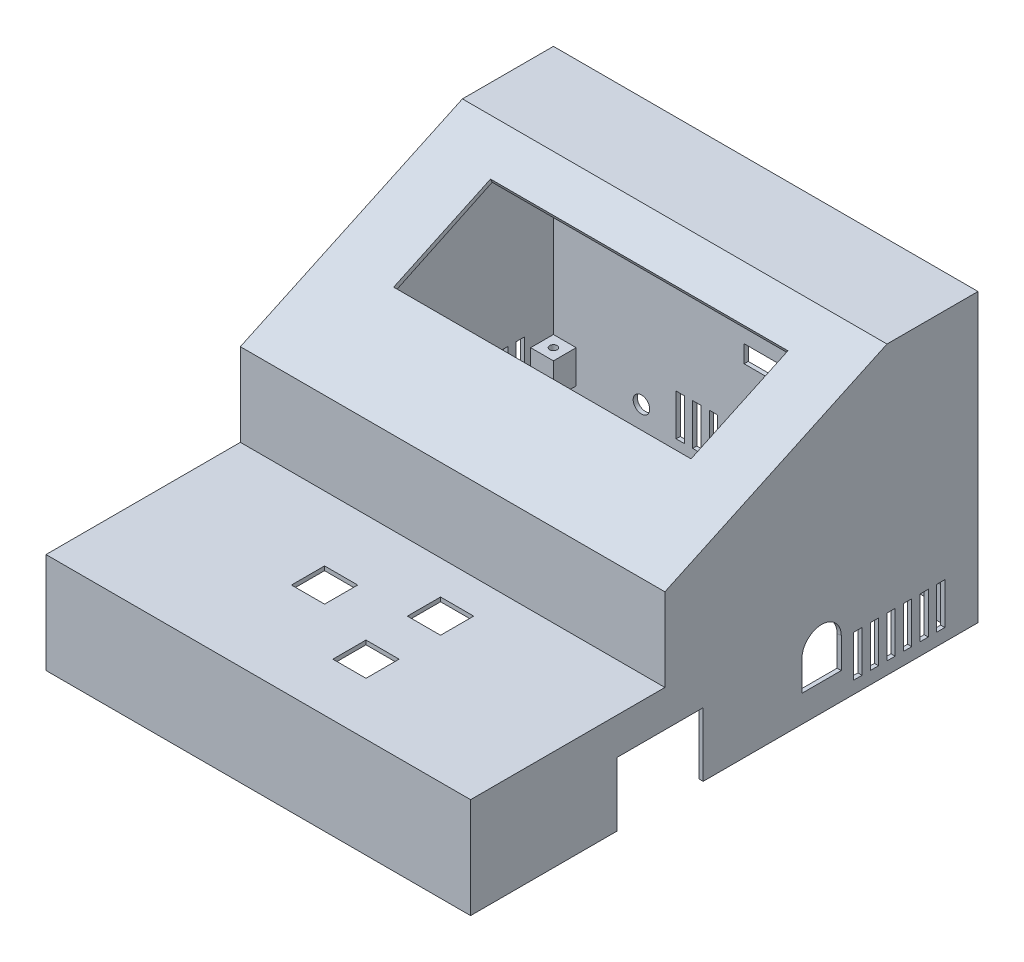
from build123d import *

# Parameters (mm, degrees)
SCHIZZO1_W                    = 104
SCHIZZO1_H                    = 124
SCHIZZO1_W_2                  = 100.5
SCHIZZO1_H_2                  = 120.5
ESTRUSIONE_ESTRUSIONE1_DEPTH  = 25.5
ESTRUSIONE_ESTRUSIONE2_START  = 5
SCHIZZO3_W                    = 5
SCHIZZO3_H                    = 5
ESTRUSIONE_ESTRUSIONE2_DEPTH  = 10
SCHIZZO4_W                    = 104
SCHIZZO4_H                    = 47.67
ESTRUSIONE_ESTRUSIONE3_DEPTH  = 1.75
SCHIZZO5_W                    = 8
SCHIZZO5_H                    = 8
TAGLIO_ESTRUSIONE1_DEPTH      = 12.75
SCHIZZO8_W                    = 8
SCHIZZO8_H                    = 8
TAGLIO_ESTRUSIONE2_DEPTH      = 12.75
ESTRUSIONE_ESTRUSIONE4_DEPTH  = 25
SCHIZZO11_W                   = 104
SCHIZZO11_H                   = 22.72
ESTRUSIONE_ESTRUSIONE5_DEPTH  = 1.75
SCHIZZO13_W                   = 1.75
SCHIZZO13_H                   = 53.61
ESTRUSIONE_ESTRUSIONE6_DEPTH  = 26.75
TAGLIO_ESTRUSIONE3_DEPTH      = 117
TAGLIO_ESTRUSIONE3_DEPTH_BACK = 41.75
LOFT4_START                   = 29.167010472
LOFT4_OUTLINE_W               = 104
LOFT4_OUTLINE_H               = 59.892229265
LOFT4_DEPTH                   = 1.586024503
SCHIZZO16_W                   = 71.8
SCHIZZO16_H                   = 25.8
TAGLIO_ESTRUSIONE4_DEPTH      = 10
SCHIZZO17_W                   = 104
SCHIZZO17_H                   = 124
SCHIZZO17_W_2                 = 100.5
SCHIZZO17_H_2                 = 120.5
ESTRUSIONE_ESTRUSIONE7_DEPTH  = 20
SCHIZZO19_W                   = 8
SCHIZZO19_H                   = 1.75
ESTRUSIONE_ESTRUSIONE8_DEPTH  = 0.25
SCHIZZO20_W                   = 7.75
SCHIZZO20_H                   = 1.75
ESTRUSIONE_ESTRUSIONE9_DEPTH  = 0.25
SCHIZZO21_W                   = 7.75
SCHIZZO21_H                   = 1.75
TAGLIO_ESTRUSIONE5_DEPTH      = 0.25
SCHIZZO22_W                   = 8
SCHIZZO22_H                   = 1.75
TAGLIO_ESTRUSIONE6_DEPTH      = 0.25
SCHIZZO23_W                   = 8
SCHIZZO23_H                   = 1.75
ESTRUSIONE_ESTRUSIONE10_DEPTH = 0.25
SCHIZZO37_W                   = 100.5
SCHIZZO37_H                   = 45.92
SCHIZZO37_W_2                 = 8
SCHIZZO37_H_2                 = 8
SCHIZZO37_W_3                 = 7.75
ESTRUSIONE_ESTRUSIONE17_DEPTH = 20
SCHIZZO38_W                   = 104
SCHIZZO38_H                   = 47.67
SCHIZZO38_W_2                 = 7.75
SCHIZZO38_H_2                 = 8
SCHIZZO38_W_3                 = 8
TAGLIO_ESTRUSIONE14_DEPTH     = 20
ESTRUSIONE_ESTRUSIONE18_REACH = 95.454
SCHIZZO39_W                   = 100.5
SCHIZZO39_H                   = 1.75
SCHIZZO31_W                   = 71.8
SCHIZZO31_H                   = 1.586024503
ESTRUSIONE_ESTRUSIONE14_DEPTH = 0.25
ESTRUSIONE_ESTRUSIONE15_DEPTH = 0.25
TAGLIO_ESTRUSIONE11_DEPTH     = 0.25
SCHIZZO34_W                   = 71.8
SCHIZZO34_H                   = 1.586024503
TAGLIO_ESTRUSIONE12_DEPTH     = 0.25
SCHIZZO35_W                   = 71.8
SCHIZZO35_H                   = 1.586024503
TAGLIO_ESTRUSIONE13_DEPTH     = 0.02
SCHIZZO36_W                   = 71.8
SCHIZZO36_H                   = 1.586024503
ESTRUSIONE_ESTRUSIONE16_DEPTH = 0.02
SCHIZZO40_W                   = 8
SCHIZZO40_H                   = 1.75
ESTRUSIONE_ESTRUSIONE19_DEPTH = 0.25
SCHIZZO41_W                   = 8
SCHIZZO41_H                   = 1.75
TAGLIO_ESTRUSIONE15_DEPTH     = 0.25
SCHIZZO42_W                   = 7.75
SCHIZZO42_H                   = 1.75
ESTRUSIONE_ESTRUSIONE20_DEPTH = 0.25
SCHIZZO43_W                   = 7.75
SCHIZZO43_H                   = 1.75
TAGLIO_ESTRUSIONE16_DEPTH     = 0.25
SCHIZZO44_W                   = 8
SCHIZZO44_H                   = 1.75
ESTRUSIONE_ESTRUSIONE21_DEPTH = 0.25
SCHIZZO45_W                   = 8
SCHIZZO45_H                   = 1.75
TAGLIO_ESTRUSIONE17_DEPTH     = 0.25
SCHIZZO46_W                   = 8
SCHIZZO46_H                   = 1.75
TAGLIO_ESTRUSIONE18_DEPTH     = 0.25
SCHIZZO48_W                   = 104
SCHIZZO48_H                   = 124
TAGLIO_ESTRUSIONE19_DEPTH     = 3
SCHIZZO49_W                   = 100.5
SCHIZZO49_H                   = 120.5
TAGLIO_ESTRUSIONE20_DEPTH     = 22.5
SCHIZZO50_W                   = 100.5
SCHIZZO50_H                   = 18.16459776
TAGLIO_ESTRUSIONE21_DEPTH     = 55.5
SCHIZZO51_W                   = 104
SCHIZZO51_H                   = 24.25
TAGLIO_ESTRUSIONE22_DEPTH     = 0.75
SCHIZZO52_W                   = 123.25
SCHIZZO52_H                   = 69.25
TAGLIO_ESTRUSIONE23_DEPTH     = 0.75
SCHIZZO53_W                   = 103.25
SCHIZZO53_H                   = 69.25
TAGLIO_ESTRUSIONE24_DEPTH     = 0.75
SCHIZZO54_W                   = 122.5
SCHIZZO54_H                   = 69.25
TAGLIO_ESTRUSIONE25_DEPTH     = 0.75
SCHIZZO55_W                   = 100.5
SCHIZZO55_H                   = 47.67
TAGLIO_ESTRUSIONE26_DEPTH     = 0.75
SCHIZZO56_W                   = 100.5
SCHIZZO56_H                   = 20.06607909
TAGLIO_ESTRUSIONE27_DEPTH     = 0.75
SCHIZZO57_W                   = 100.5
SCHIZZO57_H                   = 20.97
TAGLIO_ESTRUSIONE28_DEPTH     = 0.75
TAGLIO_ESTRUSIONE29_DEPTH     = 10
SCHIZZO59_W                   = 8.2
SCHIZZO59_H                   = 4.2
TAGLIO_ESTRUSIONE30_DEPTH     = 10
TAGLIO_ESTRUSIONE31_DEPTH     = 10
ESTRUSIONE_ESTRUSIONE22_START = -2
SCHIZZO61_W                   = 5.5
SCHIZZO61_H                   = 5.5
ESTRUSIONE_ESTRUSIONE22_DEPTH = 8
SCHIZZO62_R                   = 0.9
TAGLIO_ESTRUSIONE32_DEPTH     = 10
SCHIZZO63_W                   = 20.8
SCHIZZO63_H                   = 15.4
TAGLIO_ESTRUSIONE33_DEPTH     = 10
SCHIZZO64_R                   = 2
TAGLIO_ESTRUSIONE34_DEPTH     = 10
SCHIZZO65_W                   = 2
SCHIZZO65_H                   = 10
TAGLIO_ESTRUSIONE35_DEPTH     = 111
RIPETIZIONE_A_L1_COUNT        = 6
RIPETIZIONE_A_L1_PITCH        = 4
SCHIZZO66_W                   = 2
SCHIZZO66_H                   = 10
TAGLIO_ESTRUSIONE36_DEPTH     = 5
RIPETIZIONE_A_L2_COUNT        = 6
RIPETIZIONE_A_L2_PITCH        = 4
RIPETIZIONE_A_L3_COUNT        = 6
RIPETIZIONE_A_L3_PITCH        = 4


with BuildPart() as part:
    # Schizzo1 → Estrusione-Estrusione1 (new body)
    with BuildSketch(Plane(origin=(0, 0, 0), x_dir=(1, 0, 0), z_dir=(0, 1, 0))):
        Rectangle(SCHIZZO1_W, SCHIZZO1_H)
        Rectangle(SCHIZZO1_W_2, SCHIZZO1_H_2, mode=Mode.SUBTRACT)
    extrude(amount=ESTRUSIONE_ESTRUSIONE1_DEPTH)

    # Schizzo3 → Estrusione-Estrusione2 (add)
    with BuildSketch(Plane(origin=(0, 0, 0), x_dir=(1, 0, 0), z_dir=(0, 1, 0)).offset(ESTRUSIONE_ESTRUSIONE2_START)):
        with Locations((-47.75, 57.75)):
            Rectangle(SCHIZZO3_W, SCHIZZO3_H)
        with Locations((47.75, 57.75)):
            Rectangle(SCHIZZO3_W, SCHIZZO3_H)
        with Locations((-47.75, -57.75)):
            Rectangle(SCHIZZO3_W, SCHIZZO3_H)
        with Locations((47.75, -57.75)):
            Rectangle(SCHIZZO3_W, SCHIZZO3_H)
    extrude(amount=ESTRUSIONE_ESTRUSIONE2_DEPTH)

    # Schizzo4 → Estrusione-Estrusione3 (add)
    with BuildSketch(Plane(origin=(0, 25.5, 0), x_dir=(1, 0, 0), z_dir=(0, 1, 0))):
        with Locations((0, -38.165)):
            Rectangle(SCHIZZO4_W, SCHIZZO4_H)
    extrude(amount=ESTRUSIONE_ESTRUSIONE3_DEPTH)

    # Schizzo5 → Taglio-Estrusione1 (cut)
    with BuildSketch(Plane(origin=(0, 27.25, 0), x_dir=(1, 0, 0), z_dir=(0, 1, 0))):
        with Locations((-11.25, -34.25)):
            Rectangle(SCHIZZO5_W, SCHIZZO5_H)
    extrude(amount=-TAGLIO_ESTRUSIONE1_DEPTH, mode=Mode.SUBTRACT)

    # Schizzo8 → Taglio-Estrusione2 (cut)
    with BuildSketch(Plane(origin=(0, 27.25, 0), x_dir=(1, 0, 0), z_dir=(0, 1, 0))):
        with Locations((9.25, -44.75)):
            Rectangle(SCHIZZO8_W, SCHIZZO8_H)
        with Locations((9.25, -26.75)):
            Rectangle(SCHIZZO8_W, SCHIZZO8_H)
    extrude(amount=-TAGLIO_ESTRUSIONE2_DEPTH, mode=Mode.SUBTRACT)

    # Schizzo10 → Estrusione-Estrusione4 (add)
    with BuildSketch(Plane(origin=(0, 25.5, 0), x_dir=(1, 0, 0), z_dir=(0, 1, 0))):
        Polygon((-52, 62), (52, 62), (52, 39.28), (50.25, 39.28), (50.25, 60.25), (-50.25, 60.25), (-50.25, 39.28), (-52, 39.28), align=None)
    extrude(amount=ESTRUSIONE_ESTRUSIONE4_DEPTH)

    # Schizzo11 → Estrusione-Estrusione5 (add)
    with BuildSketch(Plane(origin=(0, 50.5, 0), x_dir=(1, 0, 0), z_dir=(0, 1, 0))):
        with Locations((0, 50.64)):
            Rectangle(SCHIZZO11_W, SCHIZZO11_H)
    extrude(amount=ESTRUSIONE_ESTRUSIONE5_DEPTH)

    # Schizzo13 → Estrusione-Estrusione6 (add)
    with BuildSketch(Plane(origin=(0, 25.5, 0), x_dir=(1, 0, 0), z_dir=(0, 1, 0))):
        with Locations((-51.125, 12.475)):
            Rectangle(SCHIZZO13_W, SCHIZZO13_H)
        with Locations((51.125, 12.475)):
            Rectangle(SCHIZZO13_W, SCHIZZO13_H)
    extrude(amount=ESTRUSIONE_ESTRUSIONE6_DEPTH)

    # Schizzo14 → Taglio-Estrusione3 (cut, two sides: drawn at the far end of the back side and taken through both)
    with BuildSketch(Plane.ZY.offset(-50.25).offset(-TAGLIO_ESTRUSIONE3_DEPTH_BACK)):
        Polygon((-39.28, 50.5), (14.33, 25.5), (14.33, 52.25), (-39.28, 52.25), align=None)
    extrude(amount=TAGLIO_ESTRUSIONE3_DEPTH + TAGLIO_ESTRUSIONE3_DEPTH_BACK, mode=Mode.SUBTRACT)

    # Loft4: read off the stored shape, not the designer's step
    # Loft4 outline → Loft4 (add)
    with BuildSketch(Plane(origin=(0, 0, 0), x_dir=(1, 0, 0), z_dir=(0, 0.9062997159413172, 0.42263556982900513)).offset(LOFT4_START)):
        with Locations((0, 27.736046734)):
            Rectangle(LOFT4_OUTLINE_W, LOFT4_OUTLINE_H)
    extrude(amount=LOFT4_DEPTH)

    # Schizzo16 → Taglio-Estrusione4 (cut)
    with BuildSketch(Plane(origin=(0, 27.871466862, 12.997326461), x_dir=(1, 0, 0), z_dir=(0, 0.9062997159413173, 0.42263556982900485))):
        with Locations((0.3, 34.489544348)):
            Rectangle(SCHIZZO16_W, SCHIZZO16_H)
    extrude(amount=-TAGLIO_ESTRUSIONE4_DEPTH, mode=Mode.SUBTRACT)

    # Schizzo17 → Estrusione-Estrusione7 (add)
    with BuildSketch(Plane.XZ):
        Rectangle(SCHIZZO17_W, SCHIZZO17_H)
        Rectangle(SCHIZZO17_W_2, SCHIZZO17_H_2, mode=Mode.SUBTRACT)
    extrude(amount=ESTRUSIONE_ESTRUSIONE7_DEPTH)

    # Schizzo19 → Estrusione-Estrusione8 (add)
    with BuildSketch(Plane(origin=(-15.25, 0, 0), x_dir=(0, 0, -1), z_dir=(1, 0, 0))):
        with Locations((-34.25, 26.375)):
            Rectangle(SCHIZZO19_W, SCHIZZO19_H)
    extrude(amount=ESTRUSIONE_ESTRUSIONE8_DEPTH)

    # Schizzo20 → Estrusione-Estrusione9 (add)
    with BuildSketch(Plane(origin=(0, 0, 38.25), x_dir=(-1, 0, 0), z_dir=(0, 0, -1))):
        with Locations((11.125, 26.375)):
            Rectangle(SCHIZZO20_W, SCHIZZO20_H)
    extrude(amount=ESTRUSIONE_ESTRUSIONE9_DEPTH)

    # Schizzo21 → Taglio-Estrusione5 (cut)
    with BuildSketch(Plane.ZY.offset(7.25)):
        with Locations((34.125, 26.375)):
            Rectangle(SCHIZZO21_W, SCHIZZO21_H)
    extrude(amount=-TAGLIO_ESTRUSIONE5_DEPTH, mode=Mode.SUBTRACT)

    # Schizzo22 → Taglio-Estrusione6 (cut)
    with BuildSketch(Plane.XY.offset(30.25)):
        with Locations((-11, 26.375)):
            Rectangle(SCHIZZO22_W, SCHIZZO22_H)
    extrude(amount=-TAGLIO_ESTRUSIONE6_DEPTH, mode=Mode.SUBTRACT)

    # Schizzo23 → Estrusione-Estrusione10 (add)
    with BuildSketch(Plane(origin=(5.25, 0, 0), x_dir=(0, 0, -1), z_dir=(1, 0, 0))):
        with Locations((-44.75, 26.375)):
            Rectangle(SCHIZZO23_W, SCHIZZO23_H)
    extrude(amount=ESTRUSIONE_ESTRUSIONE10_DEPTH)

    # Schizzo37 → Estrusione-Estrusione17 (add)
    with BuildSketch(Plane.XZ.offset(-25.5)):
        with Locations((0, 37.29)):
            Rectangle(SCHIZZO37_W, SCHIZZO37_H)
        with Locations((9.25, 26.75)):
            Rectangle(SCHIZZO37_W_2, SCHIZZO37_H_2, mode=Mode.SUBTRACT)
        with Locations((-11, 34)):
            Rectangle(SCHIZZO37_W_2, SCHIZZO37_H_2, mode=Mode.SUBTRACT)
        with Locations((9.375, 44.75)):
            Rectangle(SCHIZZO37_W_3, SCHIZZO37_H_2, mode=Mode.SUBTRACT)
    extrude(amount=ESTRUSIONE_ESTRUSIONE17_DEPTH)

    # Schizzo38 → Taglio-Estrusione14 (cut)
    with BuildSketch(Plane(origin=(0, 27.25, 0), x_dir=(1, 0, 0), z_dir=(0, 1, 0))):
        with Locations((0, -38.165)):
            Rectangle(SCHIZZO38_W, SCHIZZO38_H)
        with Locations((9.375, -44.75)):
            Rectangle(SCHIZZO38_W_2, SCHIZZO38_H_2, mode=Mode.SUBTRACT)
        with Locations((-11, -34)):
            Rectangle(SCHIZZO38_W_3, SCHIZZO38_H_2, mode=Mode.SUBTRACT)
        with Locations((9.25, -26.75)):
            Rectangle(SCHIZZO38_W_3, SCHIZZO38_H_2, mode=Mode.SUBTRACT)
    extrude(amount=-TAGLIO_ESTRUSIONE14_DEPTH, mode=Mode.SUBTRACT)

    # Estrusione-Estrusione18: up to this plane
    estrusione_estrusione18_end = Plane(origin=(52, 25.5, 14.33), z_dir=(0, -0.9062997159413173, -0.4226355698290045))
    # Schizzo39 → Estrusione-Estrusione18 (add, up to the surface)
    with BuildSketch(Plane.XZ.offset(-5.5), mode=Mode.PRIVATE) as estrusione_estrusione18_sk1:
        with Locations((0, 13.455)):
            Rectangle(SCHIZZO39_W, SCHIZZO39_H)
    estrusione_estrusione18_tool1 = split(extrude(estrusione_estrusione18_sk1.sketch, amount=-ESTRUSIONE_ESTRUSIONE18_REACH, mode=Mode.PRIVATE), bisect_by=estrusione_estrusione18_end, keep=Keep.BOTH, mode=Mode.PRIVATE)
    add(estrusione_estrusione18_tool1.solids().sort_by_distance((0, 5.5, 13.455))[0])

    # Schizzo31 → Estrusione-Estrusione14 (add)
    with BuildSketch(Plane(origin=(0, 9.124509378, -19.56659791), x_dir=(-1, 0, 0), z_dir=(0, 0.4226355698290049, -0.9062997159413173))):
        with Locations((-0.3, 29.960022724)):
            Rectangle(SCHIZZO31_W, SCHIZZO31_H)
    extrude(amount=ESTRUSIONE_ESTRUSIONE14_DEPTH)

    # Schizzo32 → Estrusione-Estrusione15 (add)
    with BuildSketch(Plane(origin=(-35.6, 0, 0), x_dir=(0, 0, -1), z_dir=(1, 0, 0))):
        Polygon((6.795846379, 37.101635133), (29.951804121, 47.899973942), (30.62211449, 46.462560385), (7.466156748, 35.664221576), align=None)
    extrude(amount=ESTRUSIONE_ESTRUSIONE15_DEPTH)

    # Schizzo33 → Taglio-Estrusione11 (cut)
    with BuildSketch(Plane.ZY.offset(-36.2)):
        Polygon((-30.62211449, 46.462560385), (-29.951804121, 47.899973942), (-6.795846379, 37.101635133), (-7.466156748, 35.664221576), align=None)
    extrude(amount=-TAGLIO_ESTRUSIONE11_DEPTH, mode=Mode.SUBTRACT)

    # Schizzo34 → Taglio-Estrusione12 (cut)
    with BuildSketch(Plane(origin=(0, 20.02850708, -42.949130582), x_dir=(1, 0, 0), z_dir=(0, -0.42263556982900485, 0.9062997159413172))):
        with Locations((0.55, 29.960022724)):
            Rectangle(SCHIZZO34_W, SCHIZZO34_H)
    extrude(amount=-TAGLIO_ESTRUSIONE12_DEPTH, mode=Mode.SUBTRACT)

    # Schizzo35 → Taglio-Estrusione13 (cut)
    with BuildSketch(Plane(origin=(0, 9.23016827, -19.793172839), x_dir=(-1, 0, 0), z_dir=(0, 0.4226355698290054, -0.9062997159413171))):
        with Locations((-0.55, 29.960022724)):
            Rectangle(SCHIZZO35_W, SCHIZZO35_H)
    extrude(amount=-TAGLIO_ESTRUSIONE13_DEPTH, mode=Mode.SUBTRACT)

    # Schizzo36 → Estrusione-Estrusione16 (add)
    with BuildSketch(Plane(origin=(0, 20.134165972, -43.175705511), x_dir=(1, 0, 0), z_dir=(0, -0.422635569829003, 0.9062997159413183))):
        with Locations((0.55, 29.960022724)):
            Rectangle(SCHIZZO36_W, SCHIZZO36_H)
    extrude(amount=ESTRUSIONE_ESTRUSIONE16_DEPTH)

    # Schizzo40 → Estrusione-Estrusione19 (add)
    with BuildSketch(Plane.ZY.offset(7)):
        with Locations((34, 6.375)):
            Rectangle(SCHIZZO40_W, SCHIZZO40_H)
    extrude(amount=ESTRUSIONE_ESTRUSIONE19_DEPTH)

    # Schizzo41 → Taglio-Estrusione15 (cut)
    with BuildSketch(Plane(origin=(-15, 0, 0), x_dir=(0, 0, -1), z_dir=(1, 0, 0))):
        with Locations((-34, 6.375)):
            Rectangle(SCHIZZO41_W, SCHIZZO41_H)
    extrude(amount=-TAGLIO_ESTRUSIONE15_DEPTH, mode=Mode.SUBTRACT)

    # Schizzo42 → Estrusione-Estrusione20 (add)
    with BuildSketch(Plane(origin=(0, 0, 48.75), x_dir=(-1, 0, 0), z_dir=(0, 0, -1))):
        with Locations((-9.375, 6.375)):
            Rectangle(SCHIZZO42_W, SCHIZZO42_H)
    extrude(amount=ESTRUSIONE_ESTRUSIONE20_DEPTH)

    # Schizzo43 → Taglio-Estrusione16 (cut)
    with BuildSketch(Plane.XY.offset(40.75)):
        with Locations((9.375, 6.375)):
            Rectangle(SCHIZZO43_W, SCHIZZO43_H)
    extrude(amount=-TAGLIO_ESTRUSIONE16_DEPTH, mode=Mode.SUBTRACT)

    # Schizzo44 → Estrusione-Estrusione21 (add)
    with BuildSketch(Plane(origin=(0, 0, 30.75), x_dir=(-1, 0, 0), z_dir=(0, 0, -1))):
        with Locations((-9.25, 6.375)):
            Rectangle(SCHIZZO44_W, SCHIZZO44_H)
    extrude(amount=ESTRUSIONE_ESTRUSIONE21_DEPTH)

    # Schizzo45 → Taglio-Estrusione17 (cut)
    with BuildSketch(Plane.XY.offset(22.75)):
        with Locations((9.25, 6.375)):
            Rectangle(SCHIZZO45_W, SCHIZZO45_H)
    extrude(amount=-TAGLIO_ESTRUSIONE17_DEPTH, mode=Mode.SUBTRACT)

    # Schizzo46 → Taglio-Estrusione18 (cut)
    with BuildSketch(Plane(origin=(5.5, 0, 0), x_dir=(0, 0, -1), z_dir=(1, 0, 0))):
        with Locations((-44.5, 6.375)):
            Rectangle(SCHIZZO46_W, SCHIZZO46_H)
    extrude(amount=-TAGLIO_ESTRUSIONE18_DEPTH, mode=Mode.SUBTRACT)

    # Schizzo48 → Taglio-Estrusione19 (cut)
    with BuildSketch(Plane.XZ.offset(20)):
        Rectangle(SCHIZZO48_W, SCHIZZO48_H)
    extrude(amount=-TAGLIO_ESTRUSIONE19_DEPTH, mode=Mode.SUBTRACT)

    # Schizzo49 → Taglio-Estrusione20 (cut)
    with BuildSketch(Plane.XZ.offset(17)):
        Rectangle(SCHIZZO49_W, SCHIZZO49_H)
    extrude(amount=-TAGLIO_ESTRUSIONE20_DEPTH, mode=Mode.SUBTRACT)

    # Schizzo50 → Taglio-Estrusione21 (cut)
    with BuildSketch(Plane.XZ.offset(17)):
        with Locations((0, -51.16770112)):
            Rectangle(SCHIZZO50_W, SCHIZZO50_H)
    extrude(amount=-TAGLIO_ESTRUSIONE21_DEPTH, mode=Mode.SUBTRACT)

    # Schizzo51 → Taglio-Estrusione22 (cut)
    with BuildSketch(Plane.XY.offset(62)):
        with Locations((0, -4.875)):
            Rectangle(SCHIZZO51_W, SCHIZZO51_H)
    extrude(amount=-TAGLIO_ESTRUSIONE22_DEPTH, mode=Mode.SUBTRACT)

    # Schizzo52 → Taglio-Estrusione23 (cut)
    with BuildSketch(Plane(origin=(52, 0, 0), x_dir=(0, 0, -1), z_dir=(1, 0, 0))):
        with Locations((0.375, 17.625)):
            Rectangle(SCHIZZO52_W, SCHIZZO52_H)
    extrude(amount=-TAGLIO_ESTRUSIONE23_DEPTH, mode=Mode.SUBTRACT)

    # Schizzo53 → Taglio-Estrusione24 (cut)
    with BuildSketch(Plane(origin=(0, 0, -62), x_dir=(-1, 0, 0), z_dir=(0, 0, -1))):
        with Locations((0.375, 17.625)):
            Rectangle(SCHIZZO53_W, SCHIZZO53_H)
    extrude(amount=-TAGLIO_ESTRUSIONE24_DEPTH, mode=Mode.SUBTRACT)

    # Schizzo54 → Taglio-Estrusione25 (cut)
    with BuildSketch(Plane.ZY.offset(52)):
        with Locations((0, 17.625)):
            Rectangle(SCHIZZO54_W, SCHIZZO54_H)
    extrude(amount=-TAGLIO_ESTRUSIONE25_DEPTH, mode=Mode.SUBTRACT)

    # Schizzo55 → Taglio-Estrusione26 (cut)
    with BuildSketch(Plane.XZ.offset(-5.5)):
        with Locations((0, 36.415)):
            Rectangle(SCHIZZO55_W, SCHIZZO55_H)
    extrude(amount=-TAGLIO_ESTRUSIONE26_DEPTH, mode=Mode.SUBTRACT)

    # Schizzo56 → Taglio-Estrusione27 (cut)
    with BuildSketch(Plane(origin=(0, 0, 12.58), x_dir=(-1, 0, 0), z_dir=(0, 0, -1))):
        with Locations((0, 16.283039545)):
            Rectangle(SCHIZZO56_W, SCHIZZO56_H)
    extrude(amount=-TAGLIO_ESTRUSIONE27_DEPTH, mode=Mode.SUBTRACT)

    # Schizzo57 → Taglio-Estrusione28 (cut)
    with BuildSketch(Plane.XZ.offset(-50.5)):
        with Locations((0, -49.765)):
            Rectangle(SCHIZZO57_W, SCHIZZO57_H)
    extrude(amount=-TAGLIO_ESTRUSIONE28_DEPTH, mode=Mode.SUBTRACT)

    # Schizzo3D1 → Taglio-Estrusione29 (cut)
    with BuildSketch(Plane(origin=(-50.25, 51.25, -39.28), x_dir=(0.8652944332998713, -0.21467843745159754, 0.4529665685164801), z_dir=(0, -0.9036488101811335, -0.42827424374835077))):
        Polygon((0, 0), (86.962090547, -50.377026587), (116.145436897, 0), (29.18334635, 50.377026587), align=None)
    extrude(amount=TAGLIO_ESTRUSIONE29_DEPTH, mode=Mode.SUBTRACT)

    # Schizzo59 → Taglio-Estrusione30 (cut)
    with BuildSketch(Plane(origin=(0, 0, -61.25), x_dir=(-1, 0, 0), z_dir=(0, 0, -1))):
        with Locations((0.1, 12)):
            Rectangle(SCHIZZO59_W, SCHIZZO59_H)
    extrude(amount=-TAGLIO_ESTRUSIONE30_DEPTH, mode=Mode.SUBTRACT)

    # Schizzo60 → Taglio-Estrusione31 (cut)
    with BuildSketch(Plane(origin=(51.25, 0, 0), x_dir=(0, 0, -1), z_dir=(1, 0, 0))):
        with BuildLine():
            Line((23.5, -10.5), (28.25, -10.5))
            Line((28.25, -10.5), (28.25, -3.25))
            ThreePointArc((28.25, -3.25), (26.858757211, -6.608757211), (23.5, -8))
            Line((23.5, -8), (23.5, -10.5))
        make_face()
        with BuildLine():
            Line((18.75, -10.5), (23.5, -10.5))
            Line((23.5, -10.5), (23.5, -8))
            ThreePointArc((23.5, -8), (20.141242789, -6.608757211), (18.75, -3.25))
            Line((18.75, -3.25), (18.75, -10.5))
        make_face()
        with BuildLine():
            ThreePointArc((23.5, -8), (26.858757211, -6.608757211), (28.25, -3.25))
            Line((28.25, -3.25), (23.5, -3.25))
            Line((23.5, -3.25), (23.5, -8))
        make_face()
        with BuildLine():
            ThreePointArc((18.75, -3.25), (20.141242789, -6.608757211), (23.5, -8))
            Line((23.5, -8), (23.5, -3.25))
            Line((23.5, -3.25), (18.75, -3.25))
        make_face()
        with BuildLine():
            Line((23.5, -3.25), (28.25, -3.25))
            ThreePointArc((28.25, -3.25), (23.5, 1.5), (18.75, -3.25))
            Line((18.75, -3.25), (23.5, -3.25))
        make_face()
    extrude(amount=-TAGLIO_ESTRUSIONE31_DEPTH, mode=Mode.SUBTRACT)

    # Schizzo61 → Estrusione-Estrusione22 (add)
    with BuildSketch(Plane.XZ.offset(17).offset(ESTRUSIONE_ESTRUSIONE22_START)):
        with Locations((-47.5, 57.5)):
            Rectangle(SCHIZZO61_W, SCHIZZO61_H)
        with Locations((-47.5, -57.5)):
            Rectangle(SCHIZZO61_W, SCHIZZO61_H)
        with Locations((47.5, -57.5)):
            Rectangle(SCHIZZO61_W, SCHIZZO61_H)
        with Locations((47.5, 57.5)):
            Rectangle(SCHIZZO61_W, SCHIZZO61_H)
    extrude(amount=-ESTRUSIONE_ESTRUSIONE22_DEPTH)

    # Schizzo62 → Taglio-Estrusione32 (cut)
    with BuildSketch(Plane.XZ.offset(15)):
        with Locations(Location((-47.5, 57.5, 0), (0, 0, 270))):
            Circle(SCHIZZO62_R)
        with Locations(Location((-47.5, -57.5, 0), (0, 0, 270))):
            Circle(SCHIZZO62_R)
        with Locations(Location((47.5, -57.5, 0), (0, 0, 270))):
            Circle(SCHIZZO62_R)
        with Locations(Location((47.5, 57.5, 0), (0, 0, 270))):
            Circle(SCHIZZO62_R)
    extrude(amount=-TAGLIO_ESTRUSIONE32_DEPTH, mode=Mode.SUBTRACT)

    # Schizzo63 → Taglio-Estrusione33 (cut)
    with BuildSketch(Plane(origin=(51.25, 0, 0), x_dir=(0, 0, -1), z_dir=(1, 0, 0))):
        with Locations((-15.5, -9.3)):
            Rectangle(SCHIZZO63_W, SCHIZZO63_H)
    extrude(amount=-TAGLIO_ESTRUSIONE33_DEPTH, mode=Mode.SUBTRACT)

    # Schizzo64 → Taglio-Estrusione34 (cut)
    with BuildSketch(Plane(origin=(0, 0, -61.25), x_dir=(-1, 0, 0), z_dir=(0, 0, -1))):
        with Locations((29, -11)):
            Circle(SCHIZZO64_R)
    extrude(amount=-TAGLIO_ESTRUSIONE34_DEPTH, mode=Mode.SUBTRACT)

    # Schizzo65 → Taglio-Estrusione35 (cut)
    with BuildSketch(Plane(origin=(51.25, 0, 0), x_dir=(0, 0, -1), z_dir=(1, 0, 0))):
        with Locations((32.25, -9)):
            Rectangle(SCHIZZO65_W, SCHIZZO65_H)
    taglio_estrusione35 = extrude(amount=-TAGLIO_ESTRUSIONE35_DEPTH, mode=Mode.SUBTRACT)

    # Ripetizione a L1: Taglio-Estrusione35 ×6
    with Locations(*[(0, 0, -i * RIPETIZIONE_A_L1_PITCH) for i in range(1, RIPETIZIONE_A_L1_COUNT)]):
        add(taglio_estrusione35, mode=Mode.SUBTRACT)

    # Schizzo66 → Taglio-Estrusione36 (cut)
    with BuildSketch(Plane(origin=(0, 0, -61.25), x_dir=(-1, 0, 0), z_dir=(0, 0, -1))):
        with Locations((-0.37699374, -9)):
            Rectangle(SCHIZZO66_W, SCHIZZO66_H)
    taglio_estrusione36 = extrude(amount=-TAGLIO_ESTRUSIONE36_DEPTH, mode=Mode.SUBTRACT)

    # Ripetizione a L2: Taglio-Estrusione36 ×6
    with Locations(*[(i * RIPETIZIONE_A_L2_PITCH, 0, 0) for i in range(1, RIPETIZIONE_A_L2_COUNT)]):
        add(taglio_estrusione36, mode=Mode.SUBTRACT)

    # Ripetizione a L3: Taglio-Estrusione36 ×6
    with Locations(*[(-i * RIPETIZIONE_A_L3_PITCH, 0, 0) for i in range(1, RIPETIZIONE_A_L3_COUNT)]):
        add(taglio_estrusione36, mode=Mode.SUBTRACT)


solid = part.part
